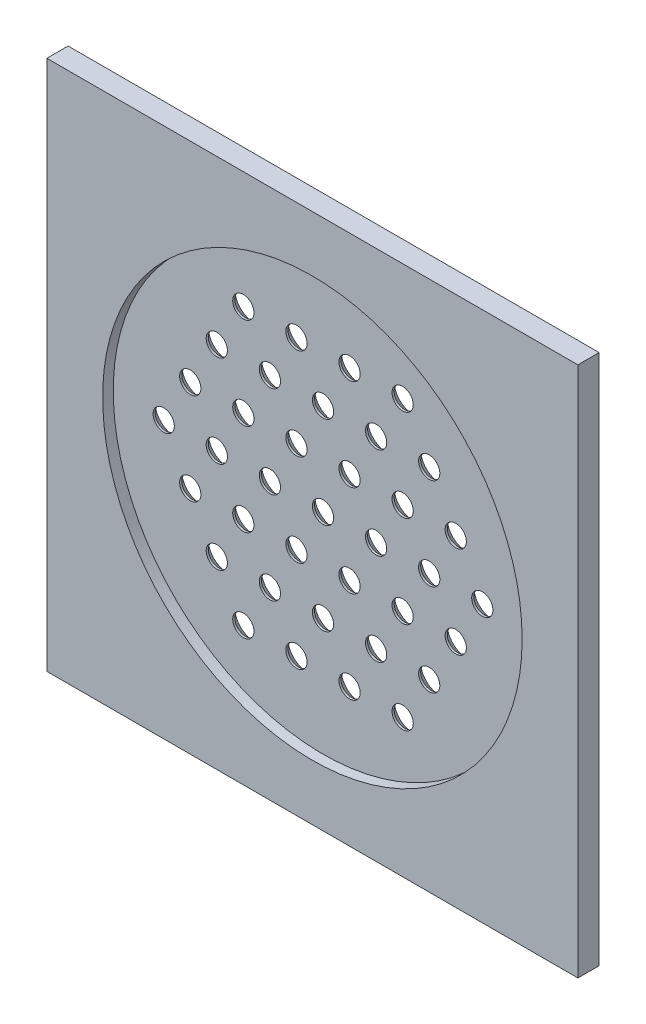
from build123d import *

# Parameters (mm, degrees)
SKETCH_1_W             = 50
SKETCH_1_H             = 50
EXTRUDE_1_DEPTH        = 2
SKETCH_2_R             = 1
CUT_EXTRUDE_1688_DEPTH = 71.738956735
SKETCH_3_R             = 19.75
CUT_EXTRUDE_2161_DEPTH = 1
CHAMFER_1_SIZE         = 0.8


with BuildPart() as part:
    # Эскиз1 → Бобышка-Вытянуть1 (new body)
    with BuildSketch(Plane(origin=(0, 66.754264805, 0), x_dir=(-1, 0, 0), z_dir=(0, 0, 1))):
        with Locations((25, 41.754264805)):
            Rectangle(SKETCH_1_W, SKETCH_1_H)
    extrude(amount=EXTRUDE_1_DEPTH)

    # Эскиз2 → Cut-Extrude 1688 (cut, through all)
    with BuildSketch(Plane.XY.offset(2)):
        with Locations((-25, 25)):
            Circle(SKETCH_2_R)
        with Locations((-20, 25)):
            Circle(SKETCH_2_R)
        with Locations((-15, 25)):
            Circle(SKETCH_2_R)
        with Locations((-10, 25)):
            Circle(SKETCH_2_R)
        with Locations((-22.5, 20.669872981)):
            Circle(SKETCH_2_R)
        with Locations((-20, 16.339745962)):
            Circle(SKETCH_2_R)
        with Locations((-17.5, 12.009618943)):
            Circle(SKETCH_2_R)
        with Locations((-27.5, 20.669872981)):
            Circle(SKETCH_2_R)
        with Locations((-30, 16.339745962)):
            Circle(SKETCH_2_R)
        with Locations((-32.5, 12.009618943)):
            Circle(SKETCH_2_R)
        with Locations((-30, 25)):
            Circle(SKETCH_2_R)
        with Locations((-35, 25)):
            Circle(SKETCH_2_R)
        with Locations((-40, 25)):
            Circle(SKETCH_2_R)
        with Locations((-27.5, 29.330127019)):
            Circle(SKETCH_2_R)
        with Locations((-30, 33.660254038)):
            Circle(SKETCH_2_R)
        with Locations((-32.5, 37.990381057)):
            Circle(SKETCH_2_R)
        with Locations((-22.5, 29.330127019)):
            Circle(SKETCH_2_R)
        with Locations((-20, 33.660254038)):
            Circle(SKETCH_2_R)
        with Locations((-17.5, 37.990381057)):
            Circle(SKETCH_2_R)
        with Locations((-25, 16.339745962)):
            Circle(SKETCH_2_R)
        with Locations((-27.5, 12.009618943)):
            Circle(SKETCH_2_R)
        with Locations((-22.5, 12.009618943)):
            Circle(SKETCH_2_R)
        with Locations((-32.5, 20.669872981)):
            Circle(SKETCH_2_R)
        with Locations((-37.5, 20.669872981)):
            Circle(SKETCH_2_R)
        with Locations((-35, 16.339745962)):
            Circle(SKETCH_2_R)
        with Locations((-32.5, 29.330127019)):
            Circle(SKETCH_2_R)
        with Locations((-35, 33.660254038)):
            Circle(SKETCH_2_R)
        with Locations((-37.5, 29.330127019)):
            Circle(SKETCH_2_R)
        with Locations((-25, 33.660254038)):
            Circle(SKETCH_2_R)
        with Locations((-22.5, 37.990381057)):
            Circle(SKETCH_2_R)
        with Locations((-27.5, 37.990381057)):
            Circle(SKETCH_2_R)
        with Locations((-17.5, 29.330127019)):
            Circle(SKETCH_2_R)
        with Locations((-12.5, 29.330127019)):
            Circle(SKETCH_2_R)
        with Locations((-15, 33.660254038)):
            Circle(SKETCH_2_R)
        with Locations((-17.5, 20.669872981)):
            Circle(SKETCH_2_R)
        with Locations((-15, 16.339745962)):
            Circle(SKETCH_2_R)
        with Locations((-12.5, 20.669872981)):
            Circle(SKETCH_2_R)
    extrude(amount=-CUT_EXTRUDE_1688_DEPTH, mode=Mode.SUBTRACT)

    # Эскиз3 → Cut-Extrude 2161 (cut)
    with BuildSketch(Plane.XY.offset(2)):
        with Locations((-25, 25)):
            Circle(SKETCH_3_R)
    extrude(amount=-CUT_EXTRUDE_2161_DEPTH, mode=Mode.SUBTRACT)

    # Фаска1
    chamfer_1_edges = [part.edges().sort_by_distance(p)[0] for p in [
        (-16, 16.339745962, 0),
        (-11, 25, 0),
        (-13.5, 20.669872981, 0),
        (-18.5, 12.009618943, 0),
        (-23.5, 12.009618943, 0),
        (-21, 16.339745962, 0),
        (-18.5, 20.669872981, 0),
        (-16, 25, 0),
        (-13.5, 29.330127019, 0),
        (-16, 33.660254038, 0),
        (-18.5, 29.330127019, 0),
        (-21, 25, 0),
        (-23.5, 20.669872981, 0),
        (-28.5, 12.009618943, 0),
        (-26, 16.339745962, 0),
        (-28.5, 20.669872981, 0),
        (-33.5, 12.009618943, 0),
        (-31, 16.339745962, 0),
        (-36, 16.339745962, 0),
        (-33.5, 20.669872981, 0),
        (-38.5, 20.669872981, 0),
        (-21, 33.660254038, 0),
        (-23.5, 29.330127019, 0),
        (-26, 25, 0),
        (-28.5, 29.330127019, 0),
        (-31, 25, 0),
        (-33.5, 29.330127019, 0),
        (-36, 25, 0),
        (-41, 25, 0),
        (-38.5, 29.330127019, 0),
        (-31, 33.660254038, 0),
        (-36, 33.660254038, 0),
        (-33.5, 37.990381057, 0),
        (-28.5, 37.990381057, 0),
        (-26, 33.660254038, 0),
        (-23.5, 37.990381057, 0),
        (-18.5, 37.990381057, 0),
    ]]
    chamfer(chamfer_1_edges, length=CHAMFER_1_SIZE)


solid = part.part
